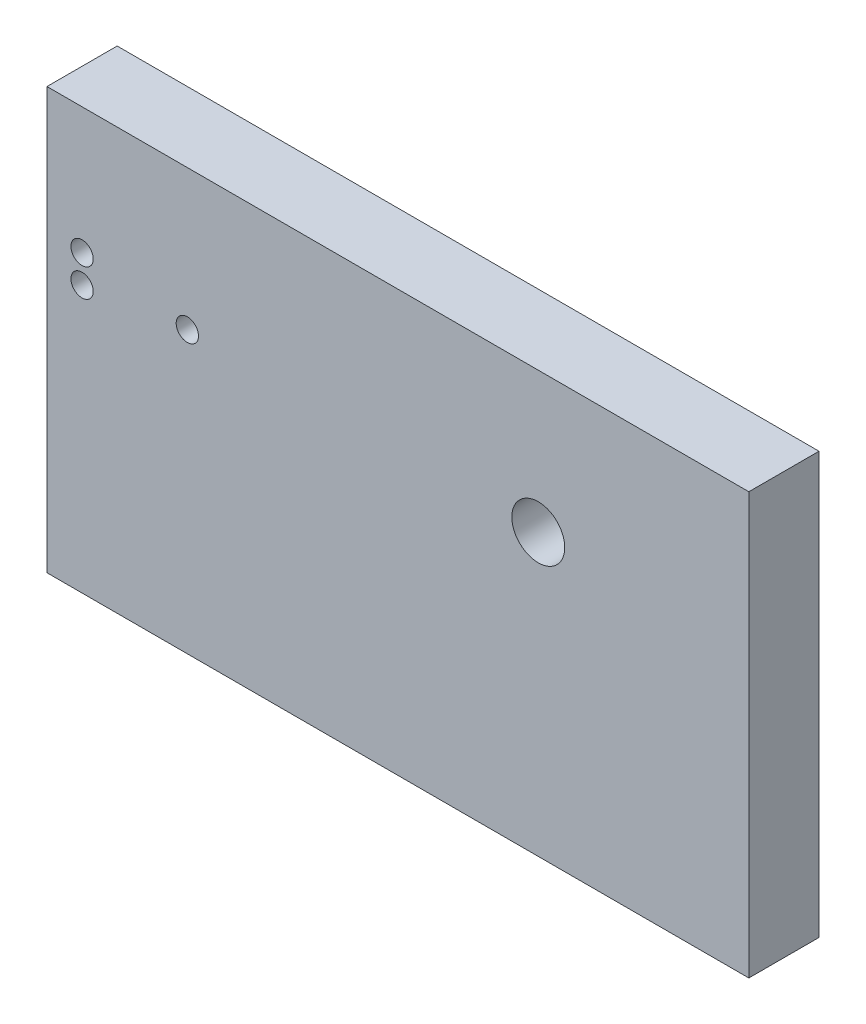
from build123d import *

# Parameters (mm, degrees)
SKETCH1_W                     = 127
SKETCH1_H                     = 76.2
BOSS_EXTRUDE1_DEPTH           = 12.7
F_1_32_0_159_DIAMETER_HOLE1_D = 4.0386
F_10_32_TAPPED_HOLE1_D        = 4.0386
F_10_32_TAPPED_HOLE1_DEPTH    = 12.7
F_10_32_TAPPED_HOLE1_TIP      = 1.213317848
V_0_377_DIAMETER_HOLE1_D      = 9.5758
F_10_32_TAPPED_HOLE2_D        = 4.0386
F_21_0_159_DIAMETER_HOLE1_D   = 4.0386


with BuildPart() as part:
    # Sketch1 → Boss-Extrude1 (new body)
    with BuildSketch(Plane.XY):
        with Locations((63.5, 38.1)):
            Rectangle(SKETCH1_W, SKETCH1_H)
    extrude(amount=BOSS_EXTRUDE1_DEPTH)

    # 1/32 (0.159) Diameter Hole1 (through all)
    with Locations(Plane.XY.offset(12.7)):
        with Locations((25.4, 50.8)):
            Hole(F_1_32_0_159_DIAMETER_HOLE1_D / 2)

    # #10-32 Tapped Hole1
    with Locations(Plane(origin=(0, 0, 0), x_dir=(-1, 0, 0), z_dir=(0, -1, 0))):
        with Locations((-19.05, -6.35), (-107.95, -6.35)):
            Hole(F_10_32_TAPPED_HOLE1_D / 2, depth=F_10_32_TAPPED_HOLE1_DEPTH)
            with Locations((0, 0, -(F_10_32_TAPPED_HOLE1_DEPTH + F_10_32_TAPPED_HOLE1_TIP / 2))):  # 118° drill point
                Cone(0, F_10_32_TAPPED_HOLE1_D / 2, F_10_32_TAPPED_HOLE1_TIP, mode=Mode.SUBTRACT)

    # V (0.377) Diameter Hole1 (through all)
    with Locations(Plane.XY.offset(12.7)):
        with Locations((88.9, 50.8)):
            Hole(V_0_377_DIAMETER_HOLE1_D / 2)

    # #10-32 Tapped Hole2 (through all)
    with Locations(Plane.XY.offset(12.7)):
        with Locations((6.35, 48.26)):
            Hole(F_10_32_TAPPED_HOLE2_D / 2)

    # #21 (0.159) Diameter Hole1 (through all)
    with Locations(Plane.XY.offset(12.7)):
        with Locations((6.35, 53.34)):
            Hole(F_21_0_159_DIAMETER_HOLE1_D / 2)


solid = part.part
